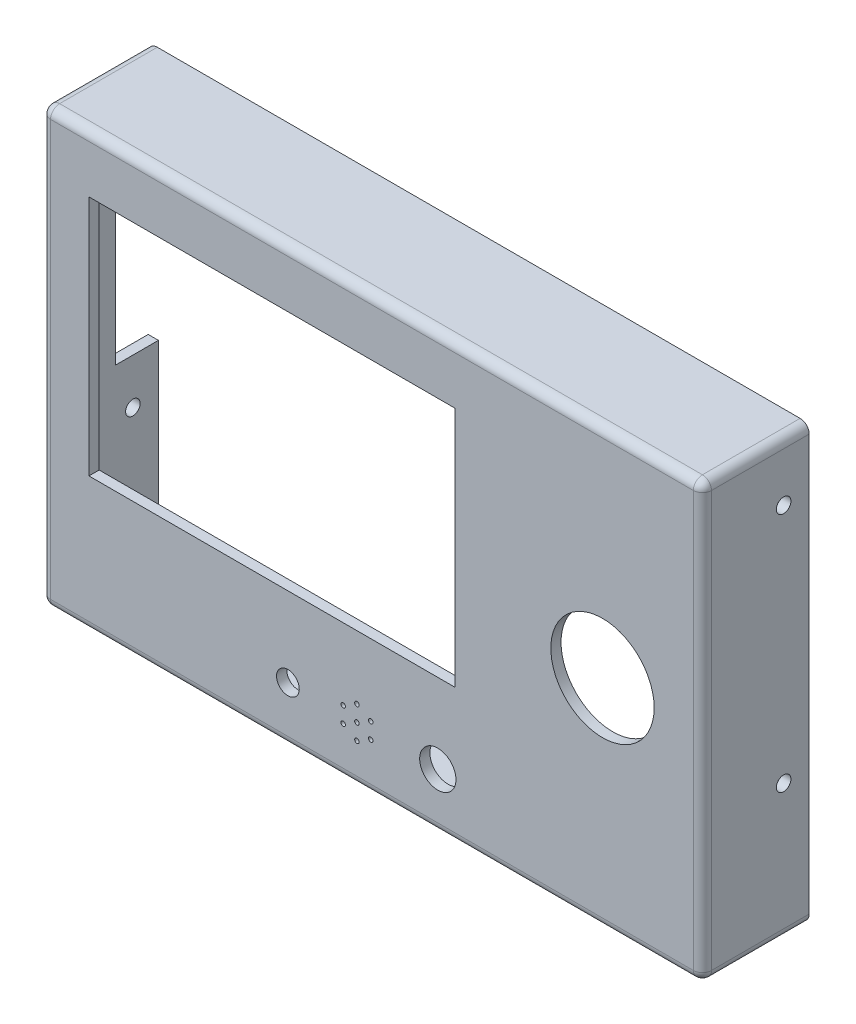
from build123d import *

# Parameters (mm, degrees)
FACE_SKETCH_W                       = 145.5
FACE_SKETCH_H                       = 95.5
FACE_SKETCH_R                       = 0.5
FACE_SKETCH_R_2                     = 2.5
FACE_SKETCH_R_3                     = 4
FACE_SKETCH_W_2                     = 80.6
FACE_SKETCH_H_2                     = 53.2
FACE_EXTRUDE_DEPTH                  = 2.25
SKETCH1_R                           = 11.375
STOP_BUTTON_MOUNTING_HOLE_CUT_DEPTH = 107.125809773
WALLS_SKETCH_W                      = 145.5
WALLS_SKETCH_H                      = 95.5
WALLS_SKETCH_W_2                    = 141
WALLS_SKETCH_H_2                    = 91
WALLS_EXTRUDE_DEPTH                 = 21.25
SD_CARD_ACCESS_SKETCH_W             = 9.5
SD_CARD_ACCESS_SKETCH_H             = 31
SD_CARD_CUT_DEPTH                   = 2.5
EDGE_RADIUS_R                       = 2
TOP_CONNECTORS_CUT_DEPTH            = 109.208999164
TOP_CONNECTORS_CUT_DEPTH_BACK       = 109.208999164
TOP_CONNECTORS_SKETCH_R             = 1.6


with BuildPart() as part:
    # Face Sketch → Face Extrude (new body)
    with BuildSketch(Plane.XY):
        with Locations((22, 0)):
            Rectangle(FACE_SKETCH_W, FACE_SKETCH_H)
        with Locations((18.7, -35.5)):
            Circle(FACE_SKETCH_R, mode=Mode.SUBTRACT)
        with Locations((3.5, -35.5)):
            Circle(FACE_SKETCH_R_2, mode=Mode.SUBTRACT)
        with Locations((36.5, -35.5)):
            Circle(FACE_SKETCH_R_3, mode=Mode.SUBTRACT)
        with Locations((18.7, -32)):
            Circle(FACE_SKETCH_R, mode=Mode.SUBTRACT)
        with Locations((21.731088913, -33.75)):
            Circle(FACE_SKETCH_R, mode=Mode.SUBTRACT)
        with Locations((21.731088913, -37.25)):
            Circle(FACE_SKETCH_R, mode=Mode.SUBTRACT)
        with Locations((18.7, -39)):
            Circle(FACE_SKETCH_R, mode=Mode.SUBTRACT)
        with Locations((15.668911087, -37.25)):
            Circle(FACE_SKETCH_R, mode=Mode.SUBTRACT)
        with Locations((15.668911087, -33.75)):
            Circle(FACE_SKETCH_R, mode=Mode.SUBTRACT)
        with Locations((0, 8.6)):
            Rectangle(FACE_SKETCH_W_2, FACE_SKETCH_H_2, mode=Mode.SUBTRACT)
    extrude(amount=FACE_EXTRUDE_DEPTH)

    # Sketch1 → Stop Button Mounting Hole Cut (cut, through all)
    with BuildSketch(Plane.XY):
        with Locations((72.75, 0)):
            Circle(SKETCH1_R)
    extrude(amount=STOP_BUTTON_MOUNTING_HOLE_CUT_DEPTH, mode=Mode.SUBTRACT)

    # Walls Sketch → Walls Extrude (add)
    with BuildSketch(Plane(origin=(0, 0, 0), x_dir=(-1, 0, 0), z_dir=(0, 0, -1))):
        with Locations((-22, 0)):
            Rectangle(WALLS_SKETCH_W, WALLS_SKETCH_H)
        with Locations((-22, 0)):
            Rectangle(WALLS_SKETCH_W_2, WALLS_SKETCH_H_2, mode=Mode.SUBTRACT)
    extrude(amount=WALLS_EXTRUDE_DEPTH)

    # SD Card Access Sketch → SD Card Cut (cut)
    with BuildSketch(Plane.ZY.offset(50.75)):
        with Locations((-16.5, 7.5)):
            Rectangle(SD_CARD_ACCESS_SKETCH_W, SD_CARD_ACCESS_SKETCH_H)
    extrude(amount=-SD_CARD_CUT_DEPTH, mode=Mode.SUBTRACT)

    # Edge Radius
    edge_radius_edges = [part.edges().sort_by_distance(p)[0] for p in [
        (-50.75, 0, 2.25),
        (94.75, 0, 2.25),
        (22, -47.75, 2.25),
        (22, 47.75, 2.25),
        (-50.75, 47.75, -9.5),
        (94.75, 47.75, -9.5),
        (94.75, -47.75, -9.5),
        (-50.75, -47.75, -9.5),
    ]]
    fillet(edge_radius_edges, radius=EDGE_RADIUS_R)

    # Top Connectors Sketch → Top Connectors Cut (cut, two sides: drawn at the far end of the back side and taken through both)
    with BuildSketch(Plane(origin=(0, 0, 0), x_dir=(0, 0, -1), z_dir=(1, 0, 0)).offset(-TOP_CONNECTORS_CUT_DEPTH_BACK)):
        with Locations((15.625, 35)):
            Circle(TOP_CONNECTORS_SKETCH_R)
        with Locations((15.625, -18)):
            Circle(TOP_CONNECTORS_SKETCH_R)
    extrude(amount=TOP_CONNECTORS_CUT_DEPTH + TOP_CONNECTORS_CUT_DEPTH_BACK, mode=Mode.SUBTRACT)


solid = part.part
